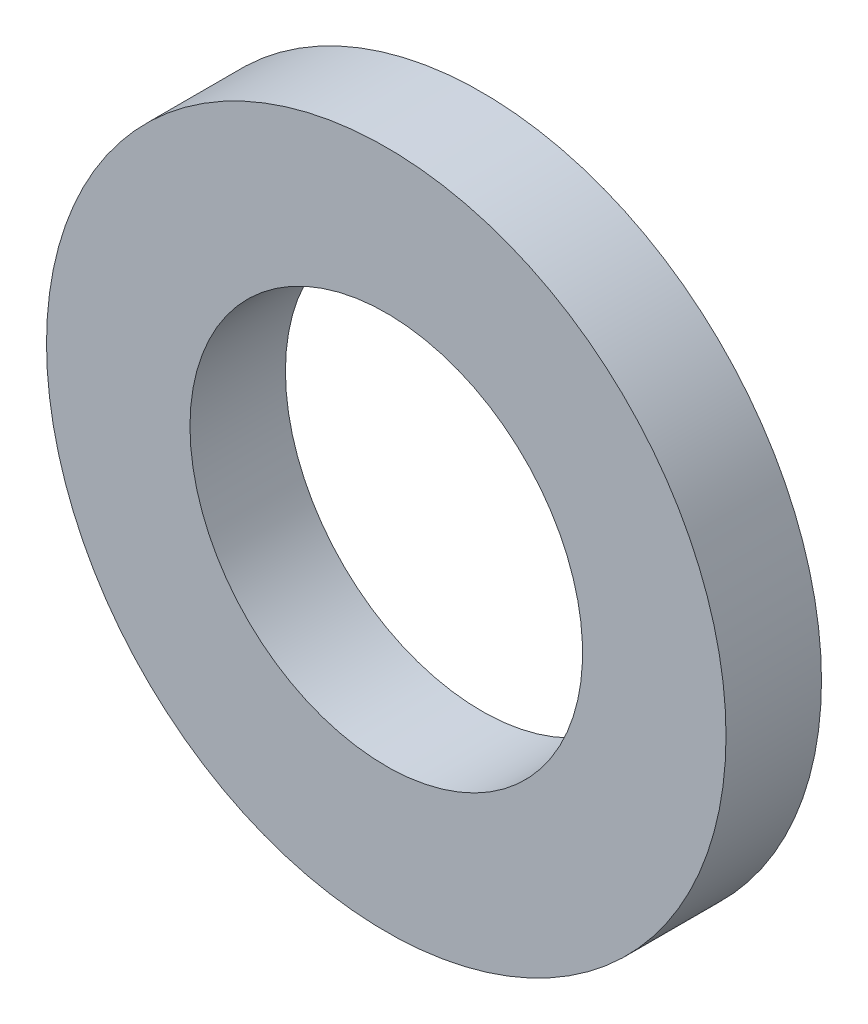
from build123d import *

# Parameters (mm, degrees)
SKETCH1_R           = 17.145
SKETCH1_R_2         = 9.906
BOSS_EXTRUDE1_DEPTH = 4.816941176


with BuildPart() as part:
    # Sketch1 → Boss-Extrude1 (new body)
    with BuildSketch(Plane.XY):
        Circle(SKETCH1_R)
        Circle(SKETCH1_R_2, mode=Mode.SUBTRACT)
    extrude(amount=BOSS_EXTRUDE1_DEPTH)


solid = part.part
